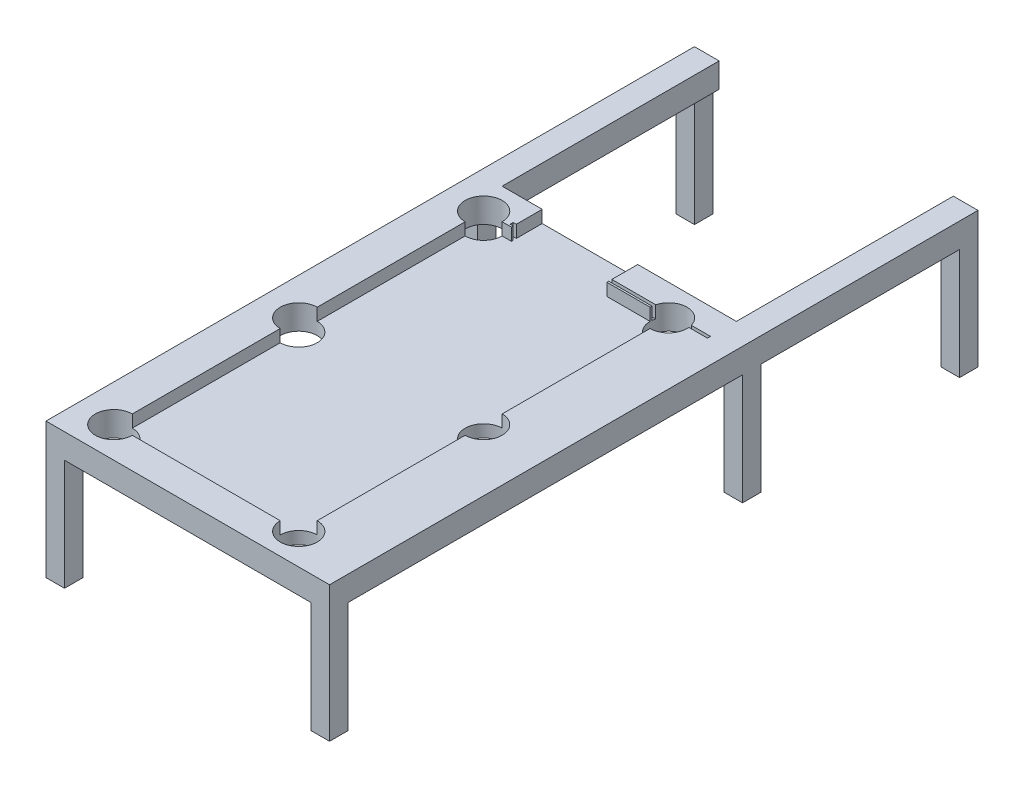
from build123d import *

# Parameters (mm, degrees)
SKETCH2_W           = 460
SKETCH2_H           = 700
SKETCH2_W_2         = 300
SKETCH2_H_2         = 600
BOSS_EXTRUDE1_DEPTH = 20
SKETCH10_W          = 460
SKETCH10_H          = 700
BOSS_EXTRUDE6_DEPTH = 20
SKETCH11_W          = 30
SKETCH11_H          = 30
BOSS_EXTRUDE7_DEPTH = 180
SKETCH14_W          = 40
SKETCH14_H          = 352
BOSS_EXTRUDE8_DEPTH = 40
SKETCH15_W          = 30
SKETCH15_H          = 30
BOSS_EXTRUDE9_DEPTH = 180
SKETCH17_R          = 30
CUT_EXTRUDE1_DEPTH  = 60
CUT_EXTRUDE2_DEPTH  = 20
SKETCH20_W          = 320
SKETCH20_H          = 5
CUT_EXTRUDE3_DEPTH  = 20


with BuildPart() as part:
    # Sketch2 → Boss-Extrude1 (new body)
    with BuildSketch(Plane(origin=(0, 0, 0), x_dir=(1, 0, 0), z_dir=(0, 1, 0))):
        with Locations((230, 350)):
            Rectangle(SKETCH2_W, SKETCH2_H)
        with Locations((210, 350)):
            Rectangle(SKETCH2_W_2, SKETCH2_H_2, mode=Mode.SUBTRACT)
    extrude(amount=BOSS_EXTRUDE1_DEPTH)

    # Sketch10 → Boss-Extrude6 (add)
    with BuildSketch(Plane.XZ):
        with Locations((230, -350)):
            Rectangle(SKETCH10_W, SKETCH10_H)
    extrude(amount=BOSS_EXTRUDE6_DEPTH)

    # Sketch11 → Boss-Extrude7 (add)
    with BuildSketch(Plane.XZ.offset(20)):
        with Locations((15, -15)):
            Rectangle(SKETCH11_W, SKETCH11_H)
        with Locations((445, -15)):
            Rectangle(SKETCH11_W, SKETCH11_H)
        with Locations((15, -685)):
            Rectangle(SKETCH11_W, SKETCH11_H)
        with Locations((445, -685)):
            Rectangle(SKETCH11_W, SKETCH11_H)
    extrude(amount=BOSS_EXTRUDE7_DEPTH)

    # Sketch14 → Boss-Extrude8 (add)
    with BuildSketch(Plane(origin=(0, 20, 0), x_dir=(1, 0, 0), z_dir=(0, 1, 0))):
        with Locations((20, 876)):
            Rectangle(SKETCH14_W, SKETCH14_H)
        with Locations((440, 876)):
            Rectangle(SKETCH14_W, SKETCH14_H)
    extrude(amount=-BOSS_EXTRUDE8_DEPTH)

    # Sketch15 → Boss-Extrude9 (add)
    with BuildSketch(Plane.XZ.offset(20)):
        with Locations((445, -1037)):
            Rectangle(SKETCH15_W, SKETCH15_H)
        with Locations((15, -1037)):
            Rectangle(SKETCH15_W, SKETCH15_H)
    extrude(amount=BOSS_EXTRUDE9_DEPTH)

    # Sketch17 → Cut-Extrude1 (cut)
    with BuildSketch(Plane(origin=(0, 20, 0), x_dir=(1, 0, 0), z_dir=(0, 1, 0))):
        with Locations((60, 650)):
            Circle(SKETCH17_R)
        with Locations((360, 650)):
            Circle(SKETCH17_R)
        with Locations((60, 350)):
            Circle(SKETCH17_R)
        with Locations((360, 350)):
            Circle(SKETCH17_R)
        with Locations((60, 50)):
            Circle(SKETCH17_R)
        with Locations((360, 50)):
            Circle(SKETCH17_R)
    extrude(amount=-CUT_EXTRUDE1_DEPTH, mode=Mode.SUBTRACT)

    # Sketch18 → Cut-Extrude2 (cut)
    with BuildSketch(Plane(origin=(0, 20, 0), x_dir=(1, 0, 0), z_dir=(0, 1, 0))):
        Polygon((182.5, 700), (260, 700), (260, 650), (210, 650), (105, 650), (105, 700), align=None)
    extrude(amount=-CUT_EXTRUDE2_DEPTH, mode=Mode.SUBTRACT)

    # Sketch20 → Cut-Extrude3 (cut)
    with BuildSketch(Plane(origin=(0, 20, 0), x_dir=(1, 0, 0), z_dir=(0, 1, 0))):
        with Locations((260, 655.5)):
            Rectangle(SKETCH20_W, SKETCH20_H)
    extrude(amount=-CUT_EXTRUDE3_DEPTH, mode=Mode.SUBTRACT)


solid = part.part
